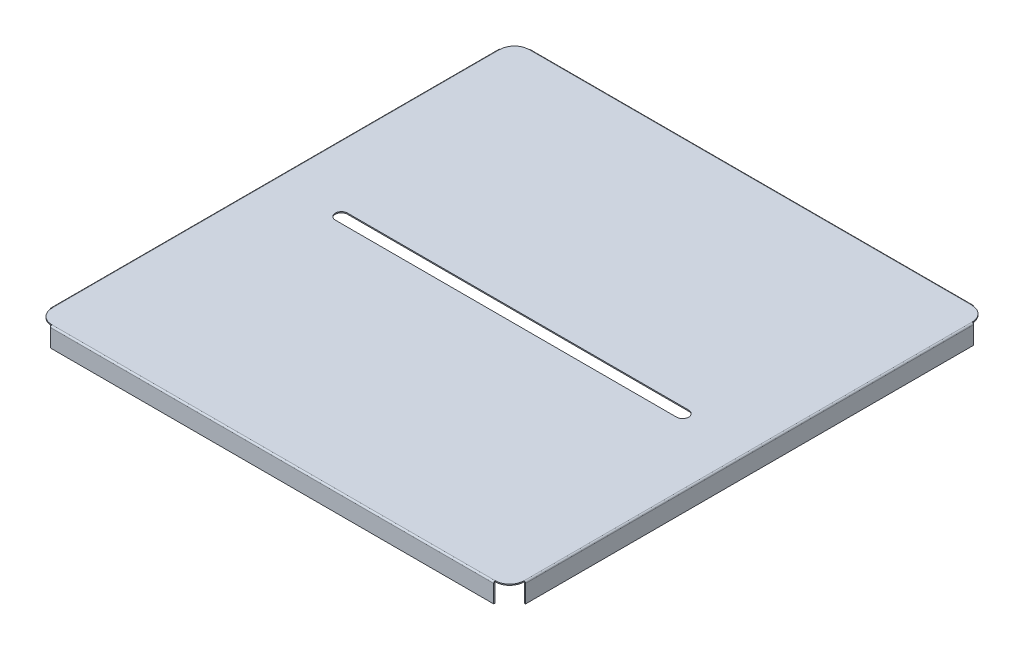
from build123d import *

# Parameters (mm, degrees)
SKETCH1_W                 = 387.38683
SKETCH1_H                 = 391.2598474
BOSS_EXTRUDE1_DEPTH       = 0.035
FILLET1_R                 = 11.811
CONVERT_SOLID1_START      = -0.854
CONVERT_SOLID1_DEPTH      = 0.854
CUT_EXTRUDE1_DEPTH        = 0.889
EDGE_FLANGE1_DEPTH        = 367.6378474
EDGE_FLANGE1_BEND_DEPTH   = 363.76483
EDGE_FLANGE1_BEND_2_DEPTH = 367.6378474
EDGE_FLANGE1_BEND_3_DEPTH = 363.76483


# Read off the part's stored shape, not the designer's step: Convert-Solid1
# Sheet-metal steps are written as plain solids
with BuildPart() as part:
    # Sketch1 → Boss-Extrude1 (new body)
    with BuildSketch(Plane(origin=(0, 0, 0), x_dir=(1, 0, 0), z_dir=(0, 1, 0))):
        Rectangle(SKETCH1_W, SKETCH1_H)
    extrude(amount=BOSS_EXTRUDE1_DEPTH)

    # Fillet1
    fillet1_edges = [part.edges().sort_by_distance(p)[0] for p in [
        (193.693415, 0.0175, -195.6299237),
        (193.693415, 0.0175, 195.6299237),
        (-193.693415, 0.0175, 195.6299237),
        (-193.693415, 0.0175, -195.6299237),
    ]]
    fillet(fillet1_edges, radius=FILLET1_R)

    # Convert-Solid1 outline → Convert-Solid1 (add)
    with BuildSketch(Plane(origin=(0, 0, 0), x_dir=(1, 0, 0), z_dir=(0, 1, 0)).offset(CONVERT_SOLID1_START)):
        with BuildLine():
            ThreePointArc((193.693415, 183.8189237), (190.234053193, 192.170561893), (181.882415, 195.6299237))
            Line((181.882415, 195.6299237), (-181.882415, 195.6299237))
            ThreePointArc((-181.882415, 195.6299237), (-190.234053193, 192.170561893), (-193.693415, 183.8189237))
            Line((-193.693415, 183.8189237), (-193.693415, -183.8189237))
            ThreePointArc((-193.693415, -183.8189237), (-190.234053193, -192.170561893), (-181.882415, -195.6299237))
            Line((-181.882415, -195.6299237), (181.882415, -195.6299237))
            ThreePointArc((181.882415, -195.6299237), (190.234053193, -192.170561893), (193.693415, -183.8189237))
            Line((193.693415, -183.8189237), (193.693415, 183.8189237))
        make_face()
    extrude(amount=CONVERT_SOLID1_DEPTH)

    # Sketch2 → Cut-Extrude1 (cut)
    with BuildSketch(Plane(origin=(0, 0.035, 0), x_dir=(1, 0, 0), z_dir=(0, 1, 0))):
        with BuildLine():
            Line((-140, 5), (140, 5))
            ThreePointArc((140, 5), (145, 0), (140, -5))
            Line((140, -5), (-140, -5))
            ThreePointArc((-140, -5), (-145, 0), (-140, 5))
        make_face()
    extrude(amount=-CUT_EXTRUDE1_DEPTH, mode=Mode.SUBTRACT)

    # Edge-Flange1 section (across the edge) → Edge-Flange1 (add)
    with BuildSketch(Plane(origin=(-194.074415, -0.854, 183.8189237), x_dir=(1, 0, 0), z_dir=(0, 0, -1))):
        with BuildLine():
            Line((-0.889, 0.381), (-0.889, 15))
            Line((-0.889, 15), (0, 15))
            Line((0, 15), (0, 0.381))
            ThreePointArc((0, 0.381), (0.111592316, 0.111592316), (0.381, 0))
            Line((0.381, 0), (0.381, -0.889))
            ThreePointArc((0.381, -0.889), (-0.517025612, -0.517025612), (-0.889, 0.381))
        make_face()
    extrude(amount=EDGE_FLANGE1_DEPTH)

    # Edge-Flange1 section 2 (across the edge) → Edge-Flange1 bend (add)
    with BuildSketch(Plane(origin=(181.882415, -0.854, 196.0109237), x_dir=(0, 0, -1), z_dir=(-1, 0, 0))):
        with BuildLine():
            Line((-0.889, 0.381), (-0.889, 15))
            Line((-0.889, 15), (0, 15))
            Line((0, 15), (0, 0.381))
            ThreePointArc((0, 0.381), (0.111592316, 0.111592316), (0.381, 0))
            Line((0.381, 0), (0.381, -0.889))
            ThreePointArc((0.381, -0.889), (-0.517025612, -0.517025612), (-0.889, 0.381))
        make_face()
    extrude(amount=EDGE_FLANGE1_BEND_DEPTH)

    # Edge-Flange1 section 3 (across the edge) → Edge-Flange1 bend 2 (add)
    with BuildSketch(Plane(origin=(194.074415, -0.854, -183.8189237), x_dir=(-1, 0, 0), z_dir=(0, 0, 1))):
        with BuildLine():
            Line((-0.889, 0.381), (-0.889, 15))
            Line((-0.889, 15), (0, 15))
            Line((0, 15), (0, 0.381))
            ThreePointArc((0, 0.381), (0.111592316, 0.111592316), (0.381, 0))
            Line((0.381, 0), (0.381, -0.889))
            ThreePointArc((0.381, -0.889), (-0.517025612, -0.517025612), (-0.889, 0.381))
        make_face()
    extrude(amount=EDGE_FLANGE1_BEND_2_DEPTH)

    # Edge-Flange1 section 4 (across the edge) → Edge-Flange1 bend 3 (add)
    with BuildSketch(Plane(origin=(-181.882415, -0.854, -196.0109237), x_dir=(0, 0, 1), z_dir=(1, 0, 0))):
        with BuildLine():
            Line((-0.889, 0.381), (-0.889, 15))
            Line((-0.889, 15), (0, 15))
            Line((0, 15), (0, 0.381))
            ThreePointArc((0, 0.381), (0.111592316, 0.111592316), (0.381, 0))
            Line((0.381, 0), (0.381, -0.889))
            ThreePointArc((0.381, -0.889), (-0.517025612, -0.517025612), (-0.889, 0.381))
        make_face()
    extrude(amount=EDGE_FLANGE1_BEND_3_DEPTH)


solid = part.part
